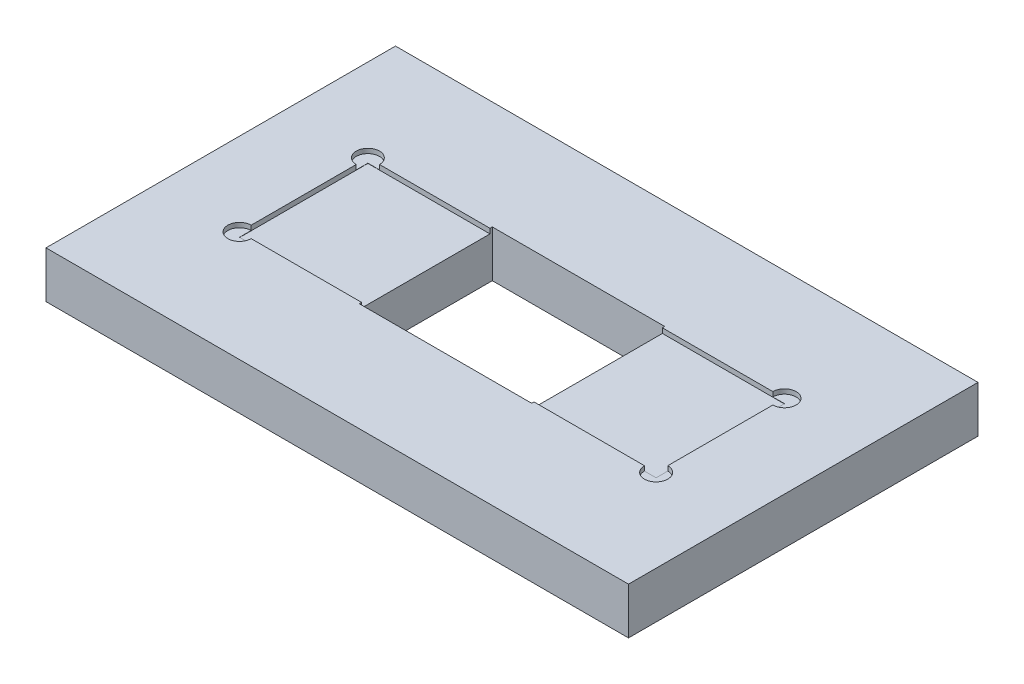
from build123d import *

# Parameters (mm, degrees)
SKETCH1_W               = 250
SKETCH1_H               = 150
BOSS_EXTRUDE1_DEPTH     = 20
SKETCH2_W               = 178.8
SKETCH2_H               = 55.1
CUT_EXTRUDE1_DEPTH      = 2.1
SKETCH3_R               = 5
CUT_EXTRUDE2_DEPTH      = 2
CUT_EXTRUDE3_DEPTH      = 147.868682843
CUT_EXTRUDE3_DEPTH_BACK = 147.868682843
SKETCH4_W               = 74
SKETCH4_H               = 57.1


with BuildPart() as part:
    # Sketch1 → Boss-Extrude1 (new body)
    with BuildSketch(Plane(origin=(0, 0, 0), x_dir=(1, 0, 0), z_dir=(0, 1, 0))):
        Rectangle(SKETCH1_W, SKETCH1_H)
    extrude(amount=-BOSS_EXTRUDE1_DEPTH)

    # Sketch2 → Cut-Extrude1 (cut)
    with BuildSketch(Plane(origin=(0, 0, 0), x_dir=(1, 0, 0), z_dir=(0, 1, 0))):
        Rectangle(SKETCH2_W, SKETCH2_H)
    extrude(amount=-CUT_EXTRUDE1_DEPTH, mode=Mode.SUBTRACT)

    # Sketch3 → Cut-Extrude2 (cut)
    with BuildSketch(Plane(origin=(0, 0, 0), x_dir=(1, 0, 0), z_dir=(0, 1, 0))):
        with Locations((-89.4, 27.55)):
            Circle(SKETCH3_R)
        with Locations((89.4, 27.55)):
            Circle(SKETCH3_R)
        with Locations((89.4, -27.55)):
            Circle(SKETCH3_R)
        with Locations((-89.4, -27.55)):
            Circle(SKETCH3_R)
    extrude(amount=-CUT_EXTRUDE2_DEPTH, mode=Mode.SUBTRACT)

    # Sketch4 → Cut-Extrude3 (cut, two sides: drawn at the far end of the back side and taken through both)
    with BuildSketch(Plane(origin=(0, -2.1, 0), x_dir=(1, 0, 0), z_dir=(0, 1, 0)).offset(-CUT_EXTRUDE3_DEPTH_BACK)):
        Rectangle(SKETCH4_W, SKETCH4_H)
    extrude(amount=CUT_EXTRUDE3_DEPTH + CUT_EXTRUDE3_DEPTH_BACK, mode=Mode.SUBTRACT)


solid = part.part
